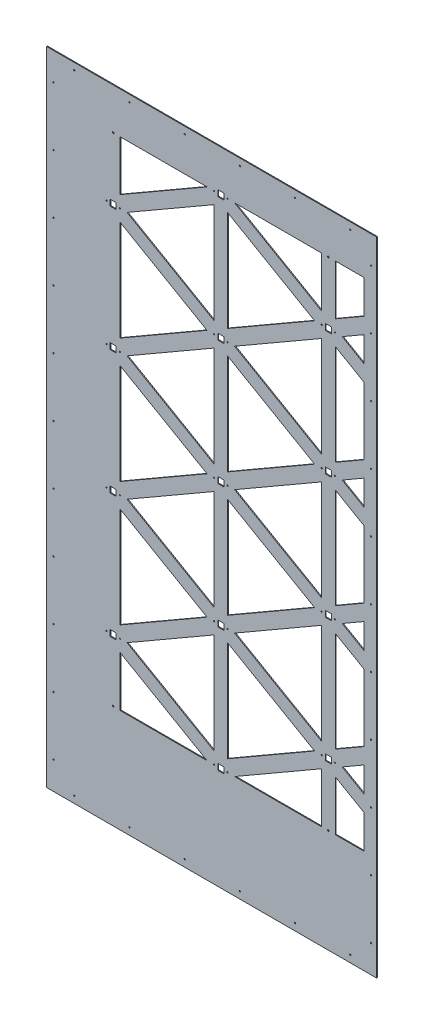
from build123d import *

# Parameters (mm, degrees)
STOCK_FRA_P05_1_OUTLINE_R   = 3
STOCK_FRA_P05_1_OUTLINE_R_2 = 2.0828
STOCK_FRA_P05_1_OUTLINE_W   = 22
STOCK_FRA_P05_1_OUTLINE_H   = 22
STOCK_FRA_P05_1_DEPTH       = 3.175
SKETCH1_W                   = 50.8
SKETCH1_H                   = 1828.8
BOSS_EXTRUDE1_DEPTH         = 3.175
SKETCH2_R                   = 2.38125
CUT_EXTRUDE1_DEPTH          = 2264.347470148
LPATTERN1_COUNT             = 6
LPATTERN1_PITCH             = 203.2
SKETCH3_R                   = 2.38125
CUT_EXTRUDE2_DEPTH          = 2264.347470148
LPATTERN2_COUNT             = 11
LPATTERN2_PITCH             = 215.9
SKETCH4_W                   = 3.175
SKETCH4_H                   = 2362.2
CUT_EXTRUDE3_DEPTH          = 5.08


# Read off the part's stored shape, not the designer's step: Stock-FRA - P05-1
with BuildPart() as part:
    # Stock-FRA - P05-1 outline → Stock-FRA - P05-1 (new body)
    with BuildSketch(Plane.XY):
        Polygon((-766.445, 146.5250829), (-609.6, 55.958961967), (-609.6, 114.619630858), (-741.046222009, 190.51987912), (-609.6, 266.410390781), (-609.6, 325.057808708), (-766.445, 234.512856945), (-766.445, 603.72608673), (-609.6, 513.162032048), (-609.6, 571.819630858), (-741.046222009, 647.71987912), (-609.6, 723.605522715), (-609.6, 782.263369407), (-766.445, 691.714675137), (-766.445, 876.3), (-609.6, 876.3), (-609.6, 1028.7), (-1828.8, 1028.7), (-1828.8, -1333.5), (-609.6, -1333.5), (-609.6, -952.5), (-766.445, -952.5), (-766.445, -767.8749171), (-609.6, -858.441038033), (-609.6, -799.780369142), (-741.046222009, -723.88012088), (-609.6, -647.989609219), (-609.6, -589.342191292), (-766.445, -679.887143055), (-766.445, -310.67391327), (-609.6, -401.237967952), (-609.6, -342.580369142), (-741.046222009, -266.68012088), (-609.6, -190.794477285), (-609.6, -132.136630593), (-766.445, -222.685324863), align=None)
        with Locations((-1583.7535, -951.693239812)):
            Circle(STOCK_FRA_P05_1_OUTLINE_R, mode=Mode.SUBTRACT)
        Polygon((-1558.3408, -767.8749171), (-1238.601797941, -952.5), (-1558.3408, -952.5), align=None, mode=Mode.SUBTRACT)
        with Locations((-1608.2408, -723.878004366)):
            Circle(STOCK_FRA_P05_1_OUTLINE_R_2, mode=Mode.SUBTRACT)
        with Locations((-1583.7408, -723.878004366)):
            Rectangle(STOCK_FRA_P05_1_OUTLINE_W, STOCK_FRA_P05_1_OUTLINE_H, mode=Mode.SUBTRACT)
        with Locations((-1559.2408, -723.878004366)):
            Circle(STOCK_FRA_P05_1_OUTLINE_R_2, mode=Mode.SUBTRACT)
        with Locations((-1608.2408, -266.68012088)):
            Circle(STOCK_FRA_P05_1_OUTLINE_R_2, mode=Mode.SUBTRACT)
        with Locations((-1583.7408, -266.68012088)):
            Rectangle(STOCK_FRA_P05_1_OUTLINE_W, STOCK_FRA_P05_1_OUTLINE_H, mode=Mode.SUBTRACT)
        with Locations((-1559.2408, -266.68012088)):
            Circle(STOCK_FRA_P05_1_OUTLINE_R_2, mode=Mode.SUBTRACT)
        Polygon((-1213.20668539, -539.280838213), (-1213.20668539, -908.503087266), (-1532.942022009, -723.88012088), align=None, mode=Mode.SUBTRACT)
        Polygon((-1558.3408, -310.67391327), (-1238.592764482, -495.3), (-1558.3408, -679.887143055), align=None, mode=Mode.SUBTRACT)
        Polygon((-1213.20668539, -82.092679503), (-1213.20668539, -451.303087266), (-1532.942022009, -266.68012088), align=None, mode=Mode.SUBTRACT)
        with Locations((-1212.30668539, -952.5)):
            Circle(STOCK_FRA_P05_1_OUTLINE_R_2, mode=Mode.SUBTRACT)
        with Locations((-1187.80668539, -952.5)):
            Rectangle(STOCK_FRA_P05_1_OUTLINE_W, STOCK_FRA_P05_1_OUTLINE_H, mode=Mode.SUBTRACT)
        with Locations((-1163.30668539, -952.5)):
            Circle(STOCK_FRA_P05_1_OUTLINE_R_2, mode=Mode.SUBTRACT)
        Polygon((-1137.00668539, -952.5), (-817.25987078, -767.894090512), (-817.25987078, -952.5), align=None, mode=Mode.SUBTRACT)
        with Locations((-791.85987078, -951.693239812)):
            Circle(STOCK_FRA_P05_1_OUTLINE_R, mode=Mode.SUBTRACT)
        with Locations((-1212.30668539, -495.3)):
            Circle(STOCK_FRA_P05_1_OUTLINE_R_2, mode=Mode.SUBTRACT)
        with Locations((-1187.80668539, -495.3)):
            Rectangle(STOCK_FRA_P05_1_OUTLINE_W, STOCK_FRA_P05_1_OUTLINE_H, mode=Mode.SUBTRACT)
        with Locations((-1163.30668539, -495.3)):
            Circle(STOCK_FRA_P05_1_OUTLINE_R_2, mode=Mode.SUBTRACT)
        Polygon((-1162.40668539, -539.294090512), (-842.65987078, -723.9), (-1162.40668539, -908.505909488), align=None, mode=Mode.SUBTRACT)
        Polygon((-817.259870779, -310.694090512), (-817.259870779, -679.905909488), (-1137.00668539, -495.3), align=None, mode=Mode.SUBTRACT)
        Polygon((-1162.40912933, -451.307320497), (-1162.40912933, -82.092679503), (-842.65987078, -266.7), align=None, mode=Mode.SUBTRACT)
        with BuildLine():
            ThreePointArc((-814.627007985, -725.055526883), (-817.526419173, -725.625462455), (-818.077862797, -722.722477487))
            ThreePointArc((-818.077862797, -722.722477487), (-815.178451606, -722.15254191), (-814.627007985, -725.055526883))
        make_face(mode=Mode.SUBTRACT)
        Polygon((-802.85987078, -712.9), (-802.845, -712.9), (-802.845, -712.878004366), (-780.845, -712.878004366), (-780.845, -734.878004366), (-780.85987078, -734.878004366), (-780.85987078, -734.9), (-802.85987078, -734.9), align=None, mode=Mode.SUBTRACT)
        with BuildLine():
            ThreePointArc((-765.627007985, -725.055526883), (-768.526419173, -725.625462455), (-769.077862797, -722.722477487))
            ThreePointArc((-769.077862797, -722.722477487), (-766.178451606, -722.15254191), (-765.627007985, -725.055526883))
        make_face(mode=Mode.SUBTRACT)
        with BuildLine():
            ThreePointArc((-814.684673439, -267.937646844), (-817.607479341, -268.367791569), (-818.020197339, -265.442474034))
            ThreePointArc((-818.020197339, -265.442474034), (-815.097391438, -265.012329311), (-814.684673439, -267.937646844))
        make_face(mode=Mode.SUBTRACT)
        Polygon((-802.85987078, -255.7), (-802.845, -255.7), (-802.845, -255.68012088), (-780.845, -255.68012088), (-780.845, -277.68012088), (-780.85987078, -277.68012088), (-780.85987078, -277.7), (-802.85987078, -277.7), align=None, mode=Mode.SUBTRACT)
        with BuildLine():
            ThreePointArc((-765.684673439, -267.937646844), (-768.607479341, -268.367791569), (-769.020197339, -265.442474034))
            ThreePointArc((-769.020197339, -265.442474034), (-766.097391438, -265.012329311), (-765.684673439, -267.937646844))
        make_face(mode=Mode.SUBTRACT)
        with Locations((-1608.2408, 190.521995634)):
            Circle(STOCK_FRA_P05_1_OUTLINE_R_2, mode=Mode.SUBTRACT)
        with Locations((-1583.7408, 190.521995634)):
            Rectangle(STOCK_FRA_P05_1_OUTLINE_W, STOCK_FRA_P05_1_OUTLINE_H, mode=Mode.SUBTRACT)
        with Locations((-1559.2408, 190.521995634)):
            Circle(STOCK_FRA_P05_1_OUTLINE_R_2, mode=Mode.SUBTRACT)
        Polygon((-1558.3408, -222.685324863), (-1558.3408, 146.5250829), (-1238.601797941, -38.1), (-1238.609129525, -38.1), align=None, mode=Mode.SUBTRACT)
        Polygon((-1532.942022009, 190.51987912), (-1213.20668539, 375.119161787), (-1213.20668539, 5.896912734), align=None, mode=Mode.SUBTRACT)
        Polygon((-1558.3408, 234.512856945), (-1558.3408, 603.72608673), (-1238.592764482, 419.1), align=None, mode=Mode.SUBTRACT)
        with Locations((-1608.2408, 647.71987912)):
            Circle(STOCK_FRA_P05_1_OUTLINE_R_2, mode=Mode.SUBTRACT)
        with Locations((-1583.7408, 647.71987912)):
            Rectangle(STOCK_FRA_P05_1_OUTLINE_W, STOCK_FRA_P05_1_OUTLINE_H, mode=Mode.SUBTRACT)
        with Locations((-1559.2408, 647.71987912)):
            Circle(STOCK_FRA_P05_1_OUTLINE_R_2, mode=Mode.SUBTRACT)
        with Locations((-1583.7535, 876.3)):
            Circle(STOCK_FRA_P05_1_OUTLINE_R, mode=Mode.SUBTRACT)
        Polygon((-1213.20668539, 463.096912734), (-1532.942022009, 647.71987912), (-1213.20668539, 832.307320497), align=None, mode=Mode.SUBTRACT)
        Polygon((-1558.3408, 691.714675137), (-1558.3408, 876.3), (-1238.609129525, 876.3), align=None, mode=Mode.SUBTRACT)
        with Locations((-1212.30668539, -38.1)):
            Circle(STOCK_FRA_P05_1_OUTLINE_R_2, mode=Mode.SUBTRACT)
        with Locations((-1187.80668539, -38.1)):
            Rectangle(STOCK_FRA_P05_1_OUTLINE_W, STOCK_FRA_P05_1_OUTLINE_H, mode=Mode.SUBTRACT)
        with Locations((-1163.30668539, -38.1)):
            Circle(STOCK_FRA_P05_1_OUTLINE_R_2, mode=Mode.SUBTRACT)
        Polygon((-1137.00668539, -38.1), (-817.25987078, 146.505909488), (-817.25987078, -222.705909488), align=None, mode=Mode.SUBTRACT)
        with Locations((-1212.30668539, 419.1)):
            Circle(STOCK_FRA_P05_1_OUTLINE_R_2, mode=Mode.SUBTRACT)
        with Locations((-1187.80668539, 419.1)):
            Rectangle(STOCK_FRA_P05_1_OUTLINE_W, STOCK_FRA_P05_1_OUTLINE_H, mode=Mode.SUBTRACT)
        with Locations((-1163.30668539, 419.1)):
            Circle(STOCK_FRA_P05_1_OUTLINE_R_2, mode=Mode.SUBTRACT)
        Polygon((-842.65987078, 190.5), (-1162.40668539, 5.894090512), (-1162.40668539, 375.105909488), align=None, mode=Mode.SUBTRACT)
        Polygon((-817.25987078, 234.494090512), (-1137.00668539, 419.1), (-817.25987078, 603.705909488), align=None, mode=Mode.SUBTRACT)
        with BuildLine():
            ThreePointArc((-814.627007985, 189.344473117), (-817.526419173, 188.774537545), (-818.077862797, 191.677522513))
            ThreePointArc((-818.077862797, 191.677522513), (-815.178451606, 192.24745809), (-814.627007985, 189.344473117))
        make_face(mode=Mode.SUBTRACT)
        Polygon((-780.85987078, 179.5), (-802.85987078, 179.5), (-802.85987078, 201.5), (-802.845, 201.5), (-802.845, 201.521995634), (-780.845, 201.521995634), (-780.845, 179.521995634), (-780.85987078, 179.521995634), align=None, mode=Mode.SUBTRACT)
        with BuildLine():
            ThreePointArc((-765.627007985, 189.344473117), (-768.526419173, 188.774537545), (-769.077862797, 191.677522513))
            ThreePointArc((-769.077862797, 191.677522513), (-766.178451606, 192.24745809), (-765.627007985, 189.344473117))
        make_face(mode=Mode.SUBTRACT)
        Polygon((-842.65987078, 647.7), (-1162.40912933, 463.092679503), (-1162.40912933, 832.307320497), align=None, mode=Mode.SUBTRACT)
        with Locations((-1212.30668539, 876.3)):
            Circle(STOCK_FRA_P05_1_OUTLINE_R_2, mode=Mode.SUBTRACT)
        with Locations((-1187.80668539, 876.3)):
            Rectangle(STOCK_FRA_P05_1_OUTLINE_W, STOCK_FRA_P05_1_OUTLINE_H, mode=Mode.SUBTRACT)
        with Locations((-1163.30668539, 876.3)):
            Circle(STOCK_FRA_P05_1_OUTLINE_R_2, mode=Mode.SUBTRACT)
        Polygon((-1137.00668539, 876.3), (-817.25987078, 876.3), (-817.25987078, 691.694090512), align=None, mode=Mode.SUBTRACT)
        with BuildLine():
            ThreePointArc((-814.684673439, 646.462353156), (-817.607479341, 646.032208431), (-818.020197339, 648.957525966))
            ThreePointArc((-818.020197339, 648.957525966), (-815.097391438, 649.387670689), (-814.684673439, 646.462353156))
        make_face(mode=Mode.SUBTRACT)
        Polygon((-780.85987078, 636.7), (-802.85987078, 636.7), (-802.85987078, 658.7), (-802.845, 658.7), (-802.845, 658.71987912), (-780.845, 658.71987912), (-780.845, 636.71987912), (-780.85987078, 636.71987912), align=None, mode=Mode.SUBTRACT)
        with BuildLine():
            ThreePointArc((-765.684673439, 646.462353156), (-768.607479341, 646.032208431), (-769.020197339, 648.957525966))
            ThreePointArc((-769.020197339, 648.957525966), (-766.097391438, 649.387670689), (-765.684673439, 646.462353156))
        make_face(mode=Mode.SUBTRACT)
        with Locations((-791.85987078, 876.3)):
            Circle(STOCK_FRA_P05_1_OUTLINE_R, mode=Mode.SUBTRACT)
    extrude(amount=STOCK_FRA_P05_1_DEPTH)

    # Sketch1 → Boss-Extrude1 (add)
    with BuildSketch(Plane.XY.offset(3.175)):
        with Locations((-635, -38.1)):
            Rectangle(SKETCH1_W, SKETCH1_H)
    extrude(amount=-BOSS_EXTRUDE1_DEPTH)

    # Sketch2 → Cut-Extrude1 (cut, through all)
    with BuildSketch(Plane.XY.offset(3.175)):
        with Locations((-1727.2, 1003.3)):
            Circle(SKETCH2_R)
        with Locations((-1727.2, -1308.1)):
            Circle(SKETCH2_R)
    cut_extrude1 = extrude(amount=-CUT_EXTRUDE1_DEPTH, mode=Mode.SUBTRACT)

    # LPattern1: Cut-Extrude1 ×6
    with Locations(*[(i * LPATTERN1_PITCH, 0, 0) for i in range(1, LPATTERN1_COUNT)]):
        add(cut_extrude1, mode=Mode.SUBTRACT)

    # Sketch3 → Cut-Extrude2 (cut, through all)
    with BuildSketch(Plane.XY.offset(3.175)):
        with Locations((-1803.4, -1231.9)):
            Circle(SKETCH3_R)
        with Locations((-635, -1231.9)):
            Circle(SKETCH3_R)
    cut_extrude2 = extrude(amount=-CUT_EXTRUDE2_DEPTH, mode=Mode.SUBTRACT)

    # LPattern2: Cut-Extrude2 ×11
    with Locations(*[(0, i * LPATTERN2_PITCH, 0) for i in range(1, LPATTERN2_COUNT)]):
        add(cut_extrude2, mode=Mode.SUBTRACT)

    # Sketch4 → Cut-Extrude3 (cut)
    with BuildSketch(Plane(origin=(-609.6, 0, 0), x_dir=(0, 0, -1), z_dir=(1, 0, 0))):
        with Locations((-1.5875, -152.4)):
            Rectangle(SKETCH4_W, SKETCH4_H)
    extrude(amount=-CUT_EXTRUDE3_DEPTH, mode=Mode.SUBTRACT)


solid = part.part
